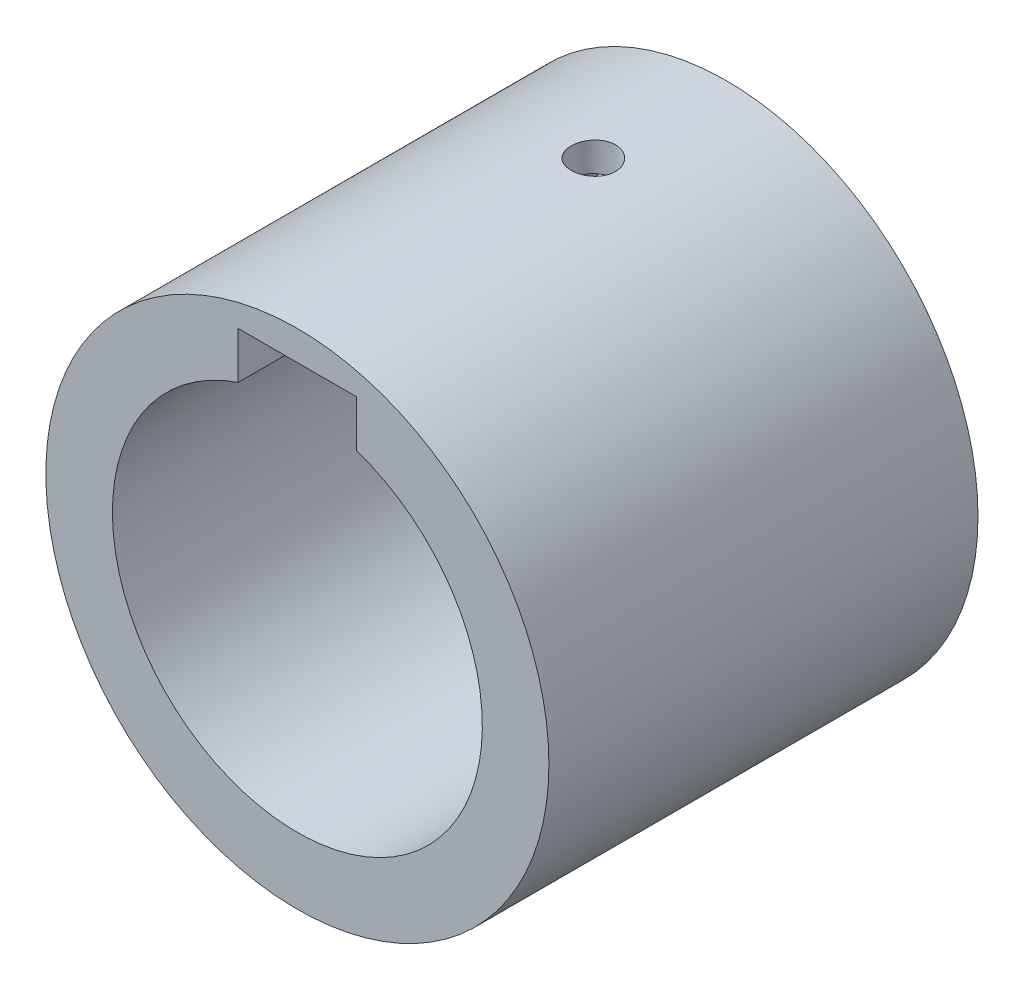
from build123d import *

# Parameters (mm, degrees)
SKETCH1_R           = 17
SKETCH1_R_2         = 12.5
BOSS_EXTRUDE1_DEPTH = 29
SKETCH2_W           = 8
SKETCH2_H           = 5
CUT_EXTRUDE2_DEPTH  = 28
FILLET3_R           = 4
FILLET4_R           = 4
SKETCH3_R           = 1.5
CUT_EXTRUDE4_DEPTH  = 47.411205606


with BuildPart() as part:
    # Sketch1 → Boss-Extrude1 (new body)
    with BuildSketch(Plane.XY):
        with Locations(Location((0, 0, 0), (0, 0, 180))):
            Circle(SKETCH1_R)
        with Locations(Location((0, 0, 0), (0, 0, 180))):
            Circle(SKETCH1_R_2, mode=Mode.SUBTRACT)
    extrude(amount=BOSS_EXTRUDE1_DEPTH)

    # Sketch2 → Cut-Extrude2 (cut)
    with BuildSketch(Plane.XY.offset(29)):
        with Locations((0, 12.5)):
            Rectangle(SKETCH2_W, SKETCH2_H)
    extrude(amount=-CUT_EXTRUDE2_DEPTH, mode=Mode.SUBTRACT)

    # Fillet3
    fillet3_edges = [part.edges().sort_by_distance(p)[0] for p in [
        (-4, 13.421359641, 1),
    ]]
    fillet(fillet3_edges, radius=FILLET3_R)

    # Fillet4
    fillet4_edges = [part.edges().sort_by_distance(p)[0] for p in [
        (4, 13.421359641, 1),
    ]]
    fillet(fillet4_edges, radius=FILLET4_R - 0.0001)  # a hair under: the kernel refuses the full size

    # Sketch3 → Cut-Extrude4 (cut, through all)
    with BuildSketch(Plane(origin=(0, 15, 0), x_dir=(-1, 0, 0), z_dir=(0, -1, 0))):
        with Locations(Location((0, -9, 0), (0, 0, 90))):
            Circle(SKETCH3_R)
    extrude(amount=-CUT_EXTRUDE4_DEPTH, mode=Mode.SUBTRACT)


solid = part.part
